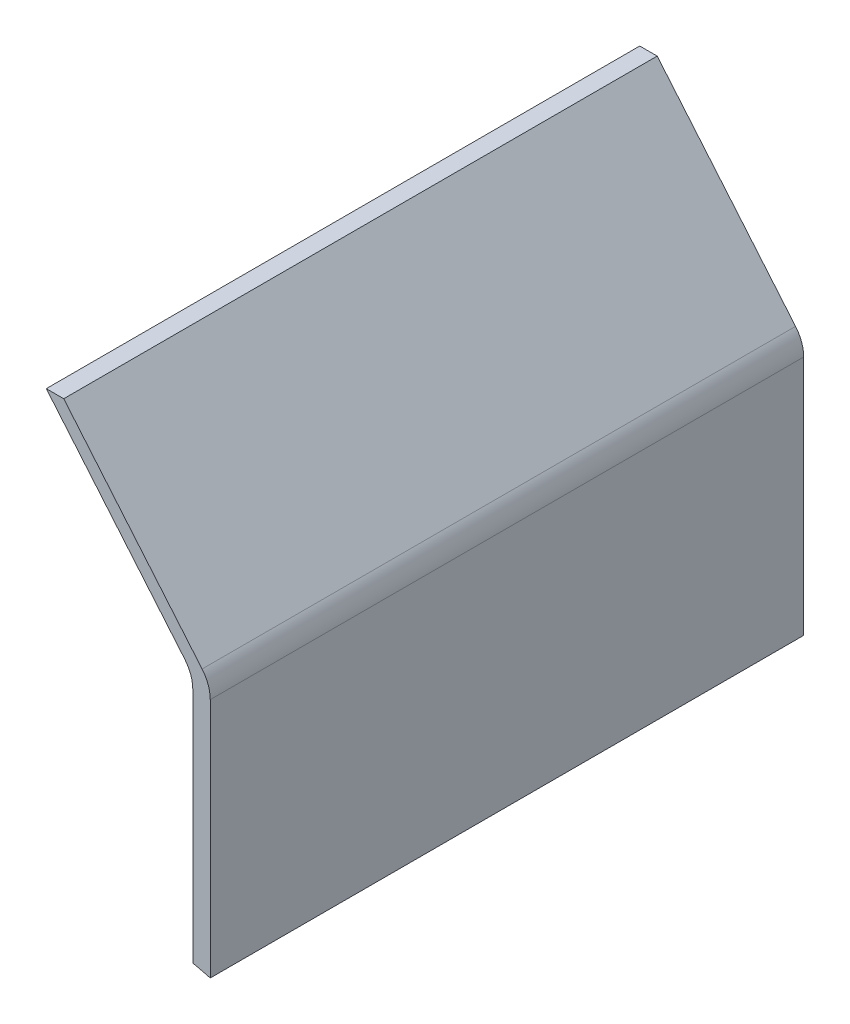
from build123d import *

# Parameters (mm, degrees)
FUNNEL_LEFT_SIDE_DEPTH = 170
FILLET1_R              = 10


with BuildPart() as part:
    # Sketch1 → Funnel - Left Side (new body)
    with BuildSketch(Plane.XY):
        with BuildLine():
            Line((-5, 1.202214955), (-5, 72.7))
            Line((-5, 72.7), (-46.974030913, 122.722702136))
            Line((-46.974030913, 122.722702136), (-41.974030913, 122.722702136))
            Line((-41.974030913, 122.722702136), (0, 72.7))
            Line((0, 72.7), (0, 0))
            ThreePointArc((0, 0), (-2.495169694, 0.621196671), (-5, 1.202214955))
        make_face()
    extrude(amount=FUNNEL_LEFT_SIDE_DEPTH)

    # Fillet1
    fillet1_edges = [part.edges().sort_by_distance(p)[0] for p in [
        (0, 72.7, 85),
        (-5, 72.7, 85),
    ]]
    fillet(fillet1_edges, radius=FILLET1_R)


solid = part.part
